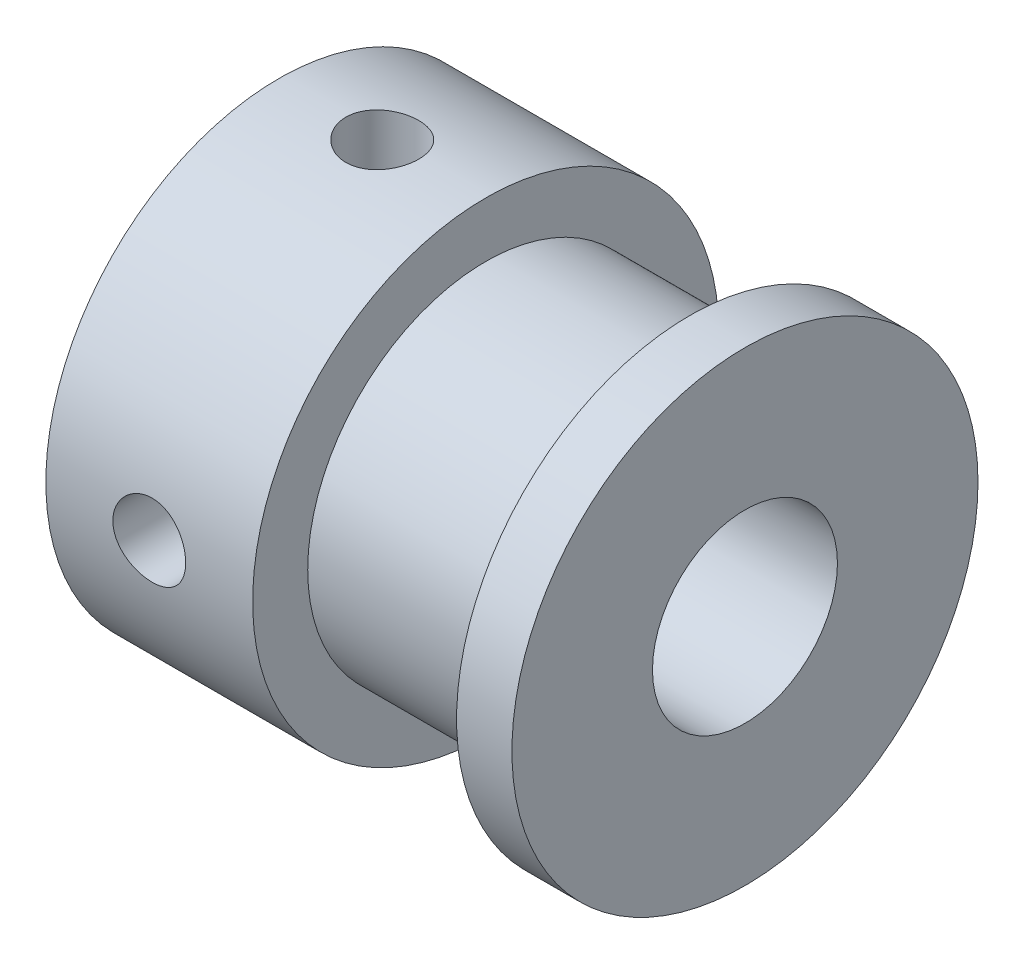
from build123d import *

# Parameters (mm, degrees)
SKETCH2_W = 1.25
SKETCH2_H = 8
SKETCH4_W = 1.25
SKETCH4_H = 8


with BuildPart() as part:
    # Sketch1 → Revolve1 (revolve)
    with BuildSketch(Plane.XY):
        Polygon((0, 3.175), (0, 8), (7.1, 8), (7.1, 6.11), (14.1, 6.11), (14.1, 8), (16, 8), (16, 3.175), align=None)
    revolve(axis=Axis((0, 0, 0), (-1, 0, 0)))

    # Sketch2 → M3x0.5 Tapped Hole1 (revolve, cut)
    with BuildSketch(Plane(origin=(3.55, 0, 0), x_dir=(0, 0, -1), z_dir=(1, 0, 0))):
        with Locations((0.625, 4)):
            Rectangle(SKETCH2_W, SKETCH2_H)
    revolve(axis=Axis((3.55, -6.35, 0), (0, 1, 0)), mode=Mode.SUBTRACT)

    # Sketch4 → M3x0.5 Tapped Hole2 (revolve, cut)
    with BuildSketch(Plane.YZ.offset(3.55)):
        with Locations((0.625, 4)):
            Rectangle(SKETCH4_W, SKETCH4_H)
    revolve(axis=Axis((3.55, 0, -6.35), (0, 0, 1)), mode=Mode.SUBTRACT)


solid = part.part
